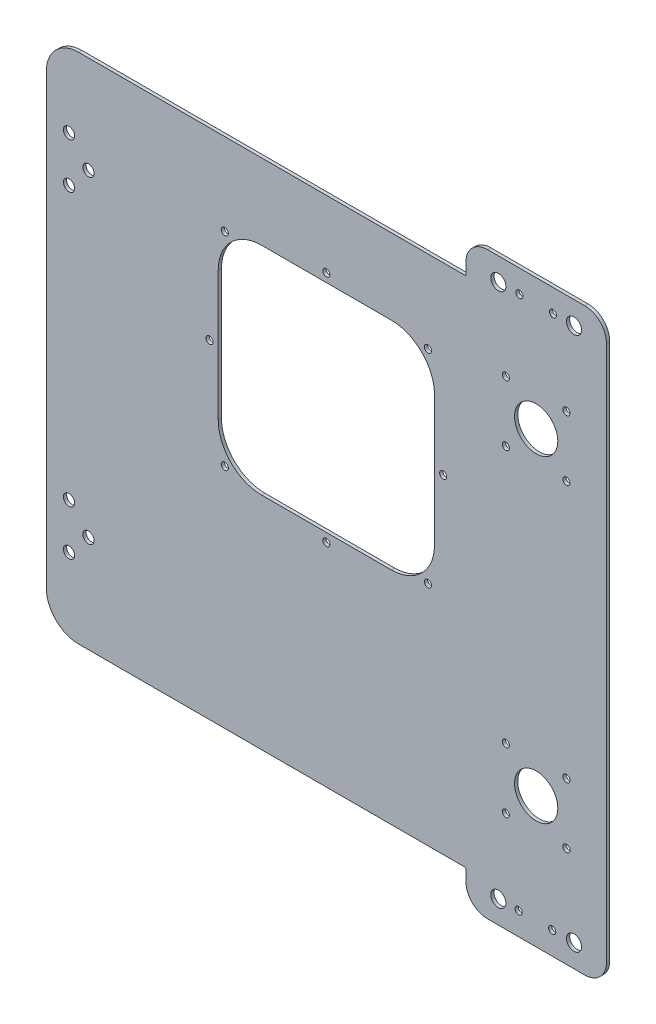
from build123d import *

# Parameters (mm, degrees)
CONVERT_SOLID1_START       = -1.5
CONVERT_SOLID1_OUTLINE_R   = 2.6
CONVERT_SOLID1_OUTLINE_R_2 = 1.65
CONVERT_SOLID1_OUTLINE_R_3 = 3.5
CONVERT_SOLID1_OUTLINE_R_4 = 10
CONVERT_SOLID1_DEPTH       = 1.5


# Read off the part's stored shape, not the designer's step: Convert-Solid1
with BuildPart() as part:
    # Convert-Solid1 outline → Convert-Solid1 (new body)
    with BuildSketch(Plane.XY.offset(CONVERT_SOLID1_START)):
        with BuildLine():
            ThreePointArc((204, 268), (196.928932188, 265.071067812), (194, 258))
            Line((194, 258), (194, 253))
            ThreePointArc((194, 253), (193.853553391, 252.646446609), (193.5, 252.5))
            Line((193.5, 252.5), (15, 252.5))
            ThreePointArc((15, 252.5), (4.393398282, 248.106601718), (0, 237.5))
            Line((0, 237.5), (0, 30.5))
            ThreePointArc((0, 30.5), (4.393398282, 19.893398282), (15, 15.5))
            Line((15, 15.5), (193.5, 15.5))
            ThreePointArc((193.5, 15.5), (193.853553391, 15.353553391), (194, 15))
            Line((194, 15), (194, 10))
            ThreePointArc((194, 10), (196.928932188, 2.928932188), (204, 0))
            Line((204, 0), (249, 0))
            ThreePointArc((249, 0), (256.071067812, 2.928932188), (259, 10))
            Line((259, 10), (259, 258))
            ThreePointArc((259, 258), (256.071067812, 265.071067812), (249, 268))
            Line((249, 268), (204, 268))
        make_face()
        with Locations((10.5, 50)):
            Circle(CONVERT_SOLID1_OUTLINE_R, mode=Mode.SUBTRACT)
        with Locations((19.5, 60.5)):
            Circle(CONVERT_SOLID1_OUTLINE_R, mode=Mode.SUBTRACT)
        with Locations((10.5, 71)):
            Circle(CONVERT_SOLID1_OUTLINE_R, mode=Mode.SUBTRACT)
        with Locations((82.529437252, 120.529437252)):
            Circle(CONVERT_SOLID1_OUTLINE_R_2, mode=Mode.SUBTRACT)
        with Locations((209, 10.5)):
            Circle(CONVERT_SOLID1_OUTLINE_R_3, mode=Mode.SUBTRACT)
        with Locations((218.380820142, 10.5)):
            Circle(CONVERT_SOLID1_OUTLINE_R_2, mode=Mode.SUBTRACT)
        with Locations((233.880820142, 10.5)):
            Circle(CONVERT_SOLID1_OUTLINE_R_2, mode=Mode.SUBTRACT)
        with Locations((244, 10.5)):
            Circle(CONVERT_SOLID1_OUTLINE_R_3, mode=Mode.SUBTRACT)
        with Locations((212.5, 46.5)):
            Circle(CONVERT_SOLID1_OUTLINE_R_2, mode=Mode.SUBTRACT)
        with Locations((226.5, 60.5)):
            Circle(CONVERT_SOLID1_OUTLINE_R_4, mode=Mode.SUBTRACT)
        with Locations((240.5, 46.5)):
            Circle(CONVERT_SOLID1_OUTLINE_R_2, mode=Mode.SUBTRACT)
        with Locations((129.5, 113.5)):
            Circle(CONVERT_SOLID1_OUTLINE_R_2, mode=Mode.SUBTRACT)
        with Locations((176.470562748, 120.529437252)):
            Circle(CONVERT_SOLID1_OUTLINE_R_2, mode=Mode.SUBTRACT)
        with Locations((212.5, 74.5)):
            Circle(CONVERT_SOLID1_OUTLINE_R_2, mode=Mode.SUBTRACT)
        with Locations((240.5, 74.5)):
            Circle(CONVERT_SOLID1_OUTLINE_R_2, mode=Mode.SUBTRACT)
        with Locations((10.5, 197)):
            Circle(CONVERT_SOLID1_OUTLINE_R, mode=Mode.SUBTRACT)
        with Locations((75.5, 167.5)):
            Circle(CONVERT_SOLID1_OUTLINE_R_2, mode=Mode.SUBTRACT)
        with Locations((19.5, 207.5)):
            Circle(CONVERT_SOLID1_OUTLINE_R, mode=Mode.SUBTRACT)
        with Locations((10.5, 218)):
            Circle(CONVERT_SOLID1_OUTLINE_R, mode=Mode.SUBTRACT)
        with Locations((82.529437252, 214.470562748)):
            Circle(CONVERT_SOLID1_OUTLINE_R_2, mode=Mode.SUBTRACT)
        with BuildLine():
            Line((179.5, 197.5), (179.5, 137.5))
            ThreePointArc((179.5, 137.5), (173.642135624, 123.357864376), (159.5, 117.5))
            Line((159.5, 117.5), (99.5, 117.5))
            ThreePointArc((99.5, 117.5), (85.357864376, 123.357864376), (79.5, 137.5))
            Line((79.5, 137.5), (79.5, 197.5))
            ThreePointArc((79.5, 197.5), (85.357864376, 211.642135624), (99.5, 217.5))
            Line((99.5, 217.5), (159.5, 217.5))
            ThreePointArc((159.5, 217.5), (173.642135624, 211.642135624), (179.5, 197.5))
        make_face(mode=Mode.SUBTRACT)
        with Locations((183.5, 167.5)):
            Circle(CONVERT_SOLID1_OUTLINE_R_2, mode=Mode.SUBTRACT)
        with Locations((212.5, 193.5)):
            Circle(CONVERT_SOLID1_OUTLINE_R_2, mode=Mode.SUBTRACT)
        with Locations((240.5, 193.5)):
            Circle(CONVERT_SOLID1_OUTLINE_R_2, mode=Mode.SUBTRACT)
        with Locations((129.5, 221.5)):
            Circle(CONVERT_SOLID1_OUTLINE_R_2, mode=Mode.SUBTRACT)
        with Locations((176.470562748, 214.470562748)):
            Circle(CONVERT_SOLID1_OUTLINE_R_2, mode=Mode.SUBTRACT)
        with Locations((226.5, 207.5)):
            Circle(CONVERT_SOLID1_OUTLINE_R_4, mode=Mode.SUBTRACT)
        with Locations((212.5, 221.5)):
            Circle(CONVERT_SOLID1_OUTLINE_R_2, mode=Mode.SUBTRACT)
        with Locations((240.5, 221.5)):
            Circle(CONVERT_SOLID1_OUTLINE_R_2, mode=Mode.SUBTRACT)
        with Locations((209, 257.5)):
            Circle(CONVERT_SOLID1_OUTLINE_R_3, mode=Mode.SUBTRACT)
        with Locations((218.75, 257.5)):
            Circle(CONVERT_SOLID1_OUTLINE_R_2, mode=Mode.SUBTRACT)
        with Locations((234.25, 257.5)):
            Circle(CONVERT_SOLID1_OUTLINE_R_2, mode=Mode.SUBTRACT)
        with Locations((244, 257.5)):
            Circle(CONVERT_SOLID1_OUTLINE_R_3, mode=Mode.SUBTRACT)
    extrude(amount=CONVERT_SOLID1_DEPTH)


solid = part.part
